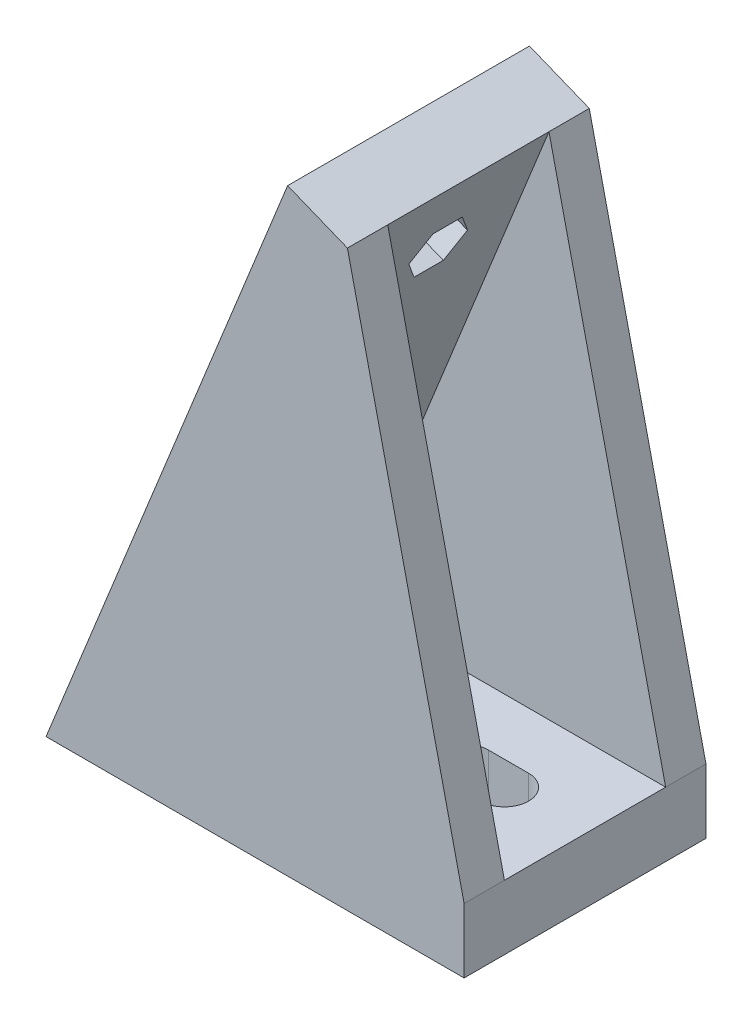
from build123d import *

# Parameters (mm, degrees)
BOSS_EXTRUDE1_DEPTH           = 15
CUT_EXTRUDE1_DEPTH            = 86.172406393
RIB1_REACH                    = 97.349
SKETCH4_WALL_W                = 257.512394394
SKETCH4_WALL_H                = 5
M3_CLEARANCE_HOLE1_AT_2_COUNT = 2
M3_CLEARANCE_HOLE1_AT_2_PITCH = 45
CUT_EXTRUDE2_DEPTH            = 3
FILLET1_R                     = 10


with BuildPart() as part:
    # Sketch1 → Boss-Extrude1 (new, symmetric)
    with BuildSketch(Plane.XY):
        Polygon((0, 0), (29.968527473, 74.174708365), (37.38599831, 71.177855618), (11.860487748, 8), (51.860487748, 8), (51.860487748, 0), align=None)
    extrude(amount=BOSS_EXTRUDE1_DEPTH, both=True)

    # Sketch2 → Cut-Extrude1 (cut, through all)
    with BuildSketch(Plane(origin=(0.379940125, 8, 0), x_dir=(1, 0, 0), z_dir=(0, 1, 0))):
        with BuildLine():
            Line((41.480547623, -3), (36.480547623, -3))
            ThreePointArc((36.480547623, -3), (33.480547623, 0), (36.480547623, 3))
            Line((36.480547623, 3), (41.480547623, 3))
            ThreePointArc((41.480547623, 3), (44.480547623, 0), (41.480547623, -3))
        make_face()
    extrude(amount=-CUT_EXTRUDE1_DEPTH, mode=Mode.SUBTRACT)

    # Sketch4 wall → Rib1 (add, up to next)
    with BuildSketch(Plane(origin=(44.623243029, 39.588927809, 15), x_dir=(0.223320905083, -0.974744978624, 0), z_dir=(0.974744978624, 0.223320905083, 0)), mode=Mode.PRIVATE) as rib1_sk1:
        with Locations((0, 2.5)):
            Rectangle(SKETCH4_WALL_W, SKETCH4_WALL_H)
    rib1_tool1 = extrude(rib1_sk1.sketch, amount=-RIB1_REACH, mode=Mode.PRIVATE) - part.part
    rib1 = rib1_tool1.solids().sort_by_distance((44.623243029, 39.588927809, 15))[0]
    add(rib1)

    # Mirror1: Rib1 across plane
    add(rib1.mirror(Plane.XY))

    # Sketch7 → M3 Clearance Hole1 (revolve, cut)
    with BuildSketch(Plane(origin=(33.639932376, 61.906017072, 0), x_dir=(0.37460659341591607, 0.9271838545667858, 0), z_dir=(0, 0, 1))):
        Polygon((0, 0), (0, 35.786334818), (1.7, 35.786334818), (1.7, 0.025), (1.725, 0), align=None)
    m3_clearance_hole1 = revolve(axis=Axis((39.527549852, 59.527265204, 0), (-0.9271838545667858, 0.37460659341591607, 0)), mode=Mode.SUBTRACT)

    # M3 Clearance Hole1 at 2: M3 Clearance Hole1 ×2
    with Locations(*[Vector(-0.37460659341591607, -0.9271838545667858, 0) * (i * M3_CLEARANCE_HOLE1_AT_2_PITCH) for i in range(1, M3_CLEARANCE_HOLE1_AT_2_COUNT)]):
        add(m3_clearance_hole1, mode=Mode.SUBTRACT)

    # Sketch8 → Cut-Extrude2 (cut)
    with BuildSketch(Plane(origin=(7.417470837, -2.996852747, 0), x_dir=(0, 0, -1), z_dir=(0.9271838545667858, -0.37460659341591607, 0))):
        Polygon((3.637306696, 70), (1.818653348, 73.15), (-1.818653348, 73.15), (-3.637306696, 70), (-1.818653348, 66.85), (1.818653348, 66.85), align=None)
        Polygon((3.637306696, 25), (1.818653348, 28.15), (-1.818653348, 28.15), (-3.637306696, 25), (-1.818653348, 21.85), (1.818653348, 21.85), align=None)
    extrude(amount=-CUT_EXTRUDE2_DEPTH, mode=Mode.SUBTRACT)

    # Fillet1
    # the kernel refuses this fillet: 10 mm, written as the material it adds along each edge
    with BuildSketch(Plane(origin=(11.860487748, 8, 47.064024213), x_dir=(0.3746065934159096, 0.9271838545667884, 0), z_dir=(0, 0, -1))) as fillet1_piece_1_section:
        with BuildLine():
            CenterArc((FILLET1_R * 1.48256096851, FILLET1_R), FILLET1_R, 158, 112)
            Line((FILLET1_R * 0.555377113946, FILLET1_R * 1.37460659342), (0, 0))
            Line((0, 0), (FILLET1_R * 1.48256096851, 0))
        make_face()
    fillet1_piece_1 = extrude(amount=94.128048426, mode=Mode.PRIVATE)
    fillet1_piece_1 = split(fillet1_piece_1, bisect_by=Plane(origin=(16.410561538, 18.315636212, 15), z_dir=(0, 0, -1)), keep=Keep.TOP, mode=Mode.PRIVATE)
    fillet1_piece_1 = split(fillet1_piece_1, bisect_by=Plane(origin=(17.191225171, 20.247846508, 3.760526332), z_dir=(-0.18730329670795798, -0.46359192728339266, 0.866025403784439)), keep=Keep.TOP, mode=Mode.PRIVATE)
    add(fillet1_piece_1)
    with BuildSketch(Plane(origin=(11.860487748, 8, 47.064024213), x_dir=(0.3746065934159096, 0.9271838545667884, 0), z_dir=(0, 0, -1))) as fillet1_piece_2_section:
        with BuildLine():
            CenterArc((FILLET1_R * 1.48256096851, FILLET1_R), FILLET1_R, 158, 112)
            Line((FILLET1_R * 0.555377113946, FILLET1_R * 1.37460659342), (0, 0))
            Line((0, 0), (FILLET1_R * 1.48256096851, 0))
        make_face()
    fillet1_piece_2 = extrude(amount=94.128048426, mode=Mode.PRIVATE)
    fillet1_piece_2 = split(fillet1_piece_2, bisect_by=Plane(origin=(16.998453552, 20.640654754, 3.929107959), z_dir=(0.18730329670795798, 0.46359192728339266, -0.866025403784439)), keep=Keep.TOP, mode=Mode.PRIVATE)
    fillet1_piece_2 = split(fillet1_piece_2, bisect_by=Plane(origin=(16.998453552, 20.640654754, 3.345505432), z_dir=(0.18730329670795837, 0.4635919272833937, 0.8660254037844384)), keep=Keep.TOP, mode=Mode.PRIVATE)
    add(fillet1_piece_2)
    with BuildSketch(Plane(origin=(11.860487748, 8, 47.064024213), x_dir=(0.3746065934159096, 0.9271838545667884, 0), z_dir=(0, 0, -1))) as fillet1_piece_3_section:
        with BuildLine():
            CenterArc((FILLET1_R * 1.48256096851, FILLET1_R), FILLET1_R, 158, 112)
            Line((FILLET1_R * 0.555377113946, FILLET1_R * 1.37460659342), (0, 0))
            Line((0, 0), (FILLET1_R * 1.48256096851, 0))
        make_face()
    fillet1_piece_3 = extrude(amount=57.064024213, mode=Mode.PRIVATE)
    fillet1_piece_3 = split(fillet1_piece_3, bisect_by=Plane(origin=(16.596548346, 16.860543337, 0), z_dir=(-0.3746065934159161, -0.9271838545667858, 0)), keep=Keep.TOP, mode=Mode.PRIVATE)
    fillet1_piece_3 = split(fillet1_piece_3, bisect_by=Plane(origin=(17.125135573, 18.168842634, 4.641292114), z_dir=(-0.18730329670795837, -0.4635919272833937, -0.8660254037844384)), keep=Keep.TOP, mode=Mode.PRIVATE)
    add(fillet1_piece_3)
    with BuildSketch(Plane(origin=(11.860487748, 8, 47.064024213), x_dir=(0.3746065934159096, 0.9271838545667884, 0), z_dir=(0, 0, -1))) as fillet1_piece_4_section:
        with BuildLine():
            CenterArc((FILLET1_R * 1.48256096851, FILLET1_R), FILLET1_R, 158, 112)
            Line((FILLET1_R * 0.555377113946, FILLET1_R * 1.37460659342), (0, 0))
            Line((0, 0), (FILLET1_R * 1.48256096851, 0))
        make_face()
    fillet1_piece_4 = extrude(amount=57.064024213, mode=Mode.PRIVATE)
    fillet1_piece_4 = split(fillet1_piece_4, bisect_by=Plane(origin=(16.526523366, 18.36657569, -2.60970235), z_dir=(-0.18730329670795812, -0.463591927283393, -0.8660254037844388)), keep=Keep.TOP, mode=Mode.PRIVATE)
    add(fillet1_piece_4)
    with BuildSketch(Plane(origin=(11.860487748, 8, 47.064024213), x_dir=(0.3746065934159096, 0.9271838545667884, 0), z_dir=(0, 0, -1))) as fillet1_piece_5_section:
        with BuildLine():
            CenterArc((FILLET1_R * 1.48256096851, FILLET1_R), FILLET1_R, 158, 112)
            Line((FILLET1_R * 0.555377113946, FILLET1_R * 1.37460659342), (0, 0))
            Line((0, 0), (FILLET1_R * 1.48256096851, 0))
        make_face()
    fillet1_piece_5 = extrude(amount=94.128048426, mode=Mode.PRIVATE)
    fillet1_piece_5 = split(fillet1_piece_5, bisect_by=Plane(origin=(16.998453552, 20.640654754, -3.929107959), z_dir=(0.18730329670795812, 0.463591927283393, 0.8660254037844388)), keep=Keep.TOP, mode=Mode.PRIVATE)
    fillet1_piece_5 = split(fillet1_piece_5, bisect_by=Plane(origin=(16.998453552, 20.640654754, -3.345505432), z_dir=(0.18730329670795812, 0.4635919272833931, -0.8660254037844387)), keep=Keep.TOP, mode=Mode.PRIVATE)
    add(fillet1_piece_5)


solid = part.part
